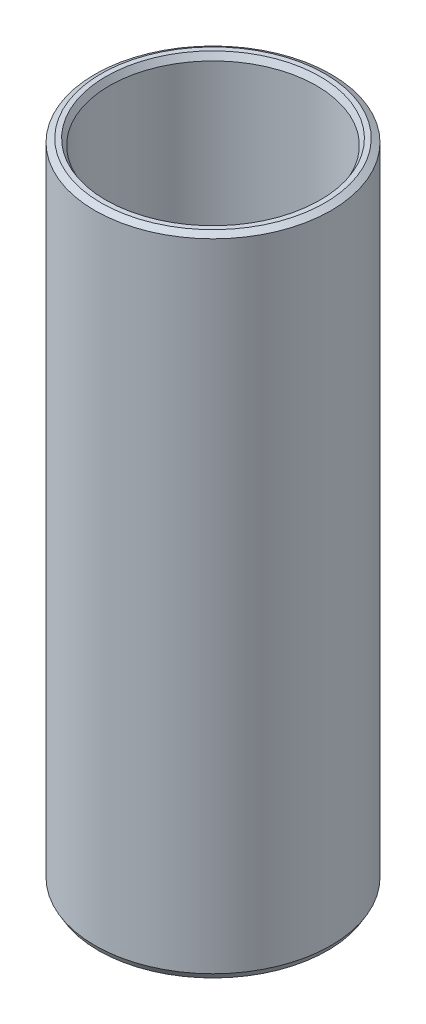
from build123d import *
from OCP.BRepFilletAPI import BRepFilletAPI_MakeChamfer

# Parameters (mm, degrees)
SKETCH1_R           = 47.5
BOSS_EXTRUDE1_DEPTH = 259.943372334
SKETCH2_R           = 41.646356365
CUT_EXTRUDE1_DEPTH  = 269.48287994
CHAMFER1_SIZE       = 1.4332993
CHAMFER1_SIZE2      = 2.48254721


with BuildPart() as part:
    # Sketch1 → Boss-Extrude1 (new body)
    with BuildSketch(Plane(origin=(0, 0, 0), x_dir=(1, 0, 0), z_dir=(0, 1, 0))):
        Circle(SKETCH1_R)
    extrude(amount=BOSS_EXTRUDE1_DEPTH)

    # Sketch2 → Cut-Extrude1 (cut, through all)
    with BuildSketch(Plane(origin=(0, 0, 0), x_dir=(1, 0, 0), z_dir=(0, 1, 0))):
        Circle(SKETCH2_R)
    extrude(amount=CUT_EXTRUDE1_DEPTH, mode=Mode.SUBTRACT)

    # Chamfer1: one chamfer whose edges measure the first distance from different faces: ONE call of the kernel's chamfer builder (chamfer() names one face for all edges)
    chamfer1_edges_1 = [part.edges().sort_by_distance(p)[0] for p in [
        (-41.646356365, 259.943372334, 0),
    ]]
    chamfer1_side_1 = [part.faces().sort_by_distance(p)[0] for p in [
        (-46.156497116, 259.943372334, 0),
    ]]
    chamfer1_edges_2 = [part.edges().sort_by_distance(p)[0] for p in [
        (-41.646356365, 0, 0),
    ]]
    chamfer1_side_2 = [part.faces().sort_by_distance(p)[0] for p in [
        (-41.646356365, 129.971686167, 0),
    ]]
    chamfer1_edges_3 = [part.edges().sort_by_distance(p)[0] for p in [
        (-47.5, 0, 0),
    ]]
    chamfer1_side_3 = [part.faces().sort_by_distance(p)[0] for p in [
        (-46.156497116, 0, 0),
    ]]
    chamfer1_edges_4 = [part.edges().sort_by_distance(p)[0] for p in [
        (-47.5, 259.943372334, 0),
    ]]
    chamfer1_side_4 = [part.faces().sort_by_distance(p)[0] for p in [
        (-47.5, 129.971686167, 0),
    ]]
    chamfer1 = BRepFilletAPI_MakeChamfer(part.part.solid().wrapped)
    for e in chamfer1_edges_1:
        chamfer1.Add(CHAMFER1_SIZE, CHAMFER1_SIZE2, e.wrapped, chamfer1_side_1[0].wrapped)  # the first distance lies on this face
    for e in chamfer1_edges_2:
        chamfer1.Add(CHAMFER1_SIZE, CHAMFER1_SIZE2, e.wrapped, chamfer1_side_2[0].wrapped)  # the first distance lies on this face
    for e in chamfer1_edges_3:
        chamfer1.Add(CHAMFER1_SIZE, CHAMFER1_SIZE2, e.wrapped, chamfer1_side_3[0].wrapped)  # the first distance lies on this face
    for e in chamfer1_edges_4:
        chamfer1.Add(CHAMFER1_SIZE, CHAMFER1_SIZE2, e.wrapped, chamfer1_side_4[0].wrapped)  # the first distance lies on this face
    add(Compound.cast(chamfer1.Shape()), mode=Mode.REPLACE)


solid = part.part
